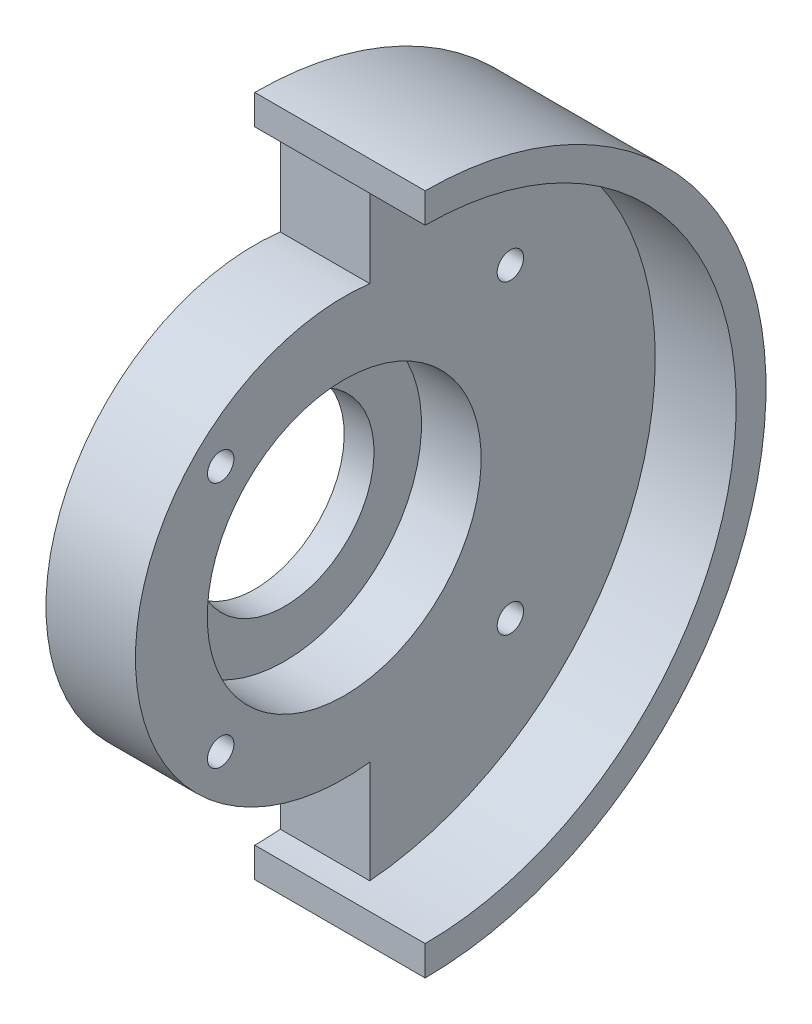
from build123d import *
from build123d.topology import SkipClean

# Parameters (mm, degrees)
CUT_EXTRUDE1_DEPTH      = 58.534772095
CUT_EXTRUDE1_DEPTH_BACK = 58.534772095
SKETCH2_R               = 1.55
SKETCH3_R               = 2.95
CUT_EXTRUDE2_DEPTH      = 4.9


with BuildPart() as part:
    # Sketch1 → Revolve1 (revolve)
    with BuildSketch(Plane.XY):
        Polygon((20, 40), (20, 36.5), (10.5, 36.5), (10.5, 16.07), (3.5, 16.07), (3.5, 10.5), (0, 10.5), (0, 40), align=None)
    revolve(axis=Axis((20, 0, 0), (-1, 0, 0)))

    # Sketch2 → Cut-Extrude1 (cut, two sides: drawn at the far end of the back side and taken through both)
    with SkipClean():  # the faces are left unmerged after this step: merging them gives an invalid solid
        with BuildSketch(Plane(origin=(10.5, 0, 0), x_dir=(0, 0, -1), z_dir=(1, 0, 0)).offset(-CUT_EXTRUDE1_DEPTH_BACK)):
            with Locations((-14.495689014, 14.495689014)):
                Circle(SKETCH2_R)
            with Locations((19.5, -17.944358445)):
                Circle(SKETCH2_R)
            with Locations((19.5, 17.944358445)):
                Circle(SKETCH2_R)
            with Locations((-14.495689014, -14.495689014)):
                Circle(SKETCH2_R)
            with BuildLine():
                Line((3, 24.315632832), (3, 36.376503405))
                ThreePointArc((3, 36.376503405), (1.501270413, 36.469112783), (0, 36.5))
                Line((0, 36.5), (0, 40))
                ThreePointArc((0, 40), (-40, 0), (0, -40))
                Line((0, -40), (0, -36.5))
                ThreePointArc((0, -36.5), (1.501270413, -36.469112783), (3, -36.376503405))
                Line((3, -36.376503405), (3, -24.315632832))
                ThreePointArc((3, -24.315632832), (-24.5, 0), (3, 24.315632832))
            make_face()
        extrude(amount=CUT_EXTRUDE1_DEPTH + CUT_EXTRUDE1_DEPTH_BACK, mode=Mode.SUBTRACT)

    # Sketch3 → Cut-Extrude2 (cut)
    with SkipClean():  # the faces are left unmerged after this step: merging them gives an invalid solid
        with BuildSketch(Plane.ZY):
            with Locations((-19.5, 17.944358445)):
                Circle(SKETCH3_R)
            with Locations((14.495689014, 14.495689014)):
                Circle(SKETCH3_R)
            with Locations((-19.5, -17.944358445)):
                Circle(SKETCH3_R)
            with Locations((14.495689014, -14.495689014)):
                Circle(SKETCH3_R)
        extrude(amount=-CUT_EXTRUDE2_DEPTH, mode=Mode.SUBTRACT)


solid = part.part
